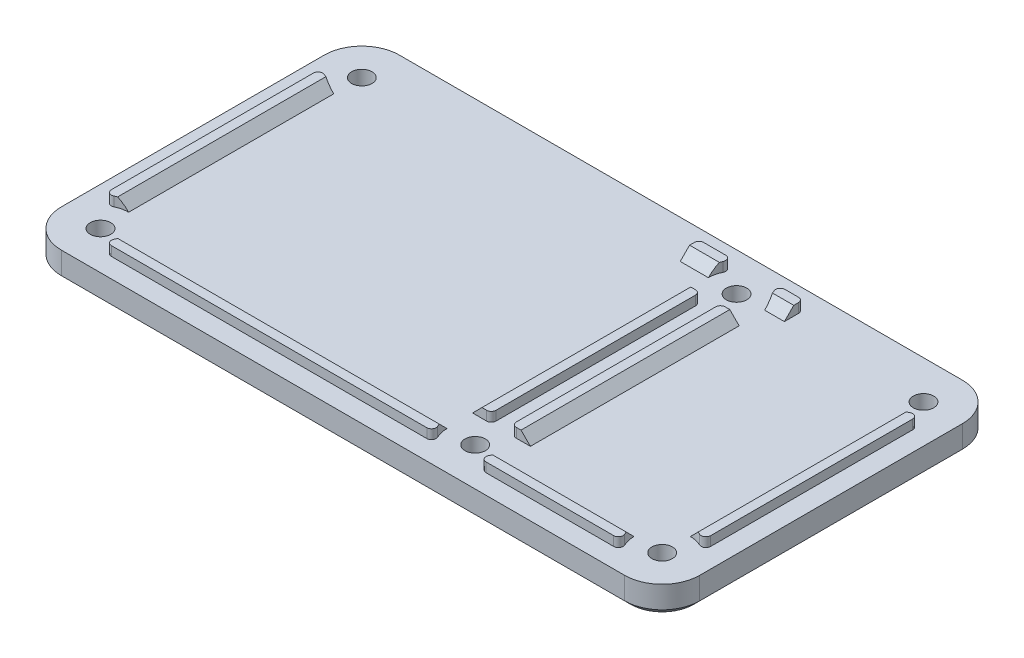
from build123d import *

# Parameters (mm, degrees)
BOSS_EXTRUDE1_DEPTH   = 4.7625
BOSS_EXTRUDE2_DEPTH   = 1.5875
SKETCH3_W             = 50.8
SKETCH3_H             = 1.5875
SKETCH3_W_2           = 20.32
CUT_EXTRUDE1_DEPTH    = 62.257755886
F_4_CLEARANCE_HOLE1_D = 3.4544
SKETCH6_R             = 4.7625
CUT_EXTRUDE2_DEPTH    = 62.257755886
SKETCH7_W             = 8.127020596
SKETCH7_H             = 2.415508094
SKETCH7_W_2           = 9.383301438
SKETCH7_H_2           = 3.436417543
CUT_EXTRUDE3_DEPTH    = 62.257755886
CHAMFER1_SIZE         = 1.5875
FILLET1_R             = 0.79375
CHAMFER2_SIZE         = 1.016


with BuildPart() as part:
    # Sketch1 → Boss-Extrude1 (new body)
    with BuildSketch(Plane(origin=(0, 0, 0), x_dir=(1, 0, 0), z_dir=(0, 1, 0))):
        with BuildLine():
            Line((-47.625, 28.575), (47.625, 28.575))
            ThreePointArc((47.625, 28.575), (52.115128061, 26.715128061), (53.975, 22.225))
            Line((53.975, 22.225), (53.975, -22.225))
            ThreePointArc((53.975, -22.225), (52.115128061, -26.715128061), (47.625, -28.575))
            Line((47.625, -28.575), (-47.625, -28.575))
            ThreePointArc((-47.625, -28.575), (-52.115128061, -26.715128061), (-53.975, -22.225))
            Line((-53.975, -22.225), (-53.975, 22.225))
            ThreePointArc((-53.975, 22.225), (-52.115128061, 26.715128061), (-47.625, 28.575))
        make_face()
    extrude(amount=BOSS_EXTRUDE1_DEPTH)

    # Sketch2 → Boss-Extrude2 (add)
    # profile 1 of 2: a face of its own
    with BuildSketch(Plane(origin=(0, 4.7625, 0), x_dir=(1, 0, 0), z_dir=(0, 1, 0))):
        with BuildLine():
            Line((-50.673, 22.225), (-50.673, -22.225))
            ThreePointArc((-50.673, -22.225), (-49.780261469, -24.380261469), (-47.625, -25.273))
            Line((-47.625, -25.273), (14.1605, -25.273))
            Line((14.1605, -25.273), (14.1605, 25.273))
            Line((14.1605, 25.273), (-47.625, 25.273))
            ThreePointArc((-47.625, 25.273), (-49.780261469, 24.380261469), (-50.673, 22.225))
        make_face()
        with BuildLine():
            Line((12.573, -23.6855), (-47.625, -23.6855))
            ThreePointArc((-47.625, -23.6855), (-48.657729454, -23.257729454), (-49.0855, -22.225))
            Line((-49.0855, -22.225), (-49.0855, 22.225))
            ThreePointArc((-49.0855, 22.225), (-48.657729454, 23.257729454), (-47.625, 23.6855))
            Line((-47.625, 23.6855), (12.573, 23.6855))
            Line((12.573, 23.6855), (12.573, -23.6855))
        make_face(mode=Mode.SUBTRACT)
    # profile 2 of 2: a face of its own
    with BuildSketch(Plane(origin=(0, 4.7625, 0), x_dir=(1, 0, 0), z_dir=(0, 1, 0))):
        with BuildLine():
            Line((47.625, -25.273), (17.5895, -25.273))
            Line((17.5895, -25.273), (17.5895, 25.273))
            Line((17.5895, 25.273), (47.625, 25.273))
            ThreePointArc((47.625, 25.273), (49.780261469, 24.380261469), (50.673, 22.225))
            Line((50.673, 22.225), (50.673, -22.225))
            ThreePointArc((50.673, -22.225), (49.780261469, -24.380261469), (47.625, -25.273))
        make_face()
        with BuildLine():
            Line((19.177, -23.6855), (19.177, 23.6855))
            Line((19.177, 23.6855), (47.625, 23.6855))
            ThreePointArc((47.625, 23.6855), (48.657729454, 23.257729454), (49.0855, 22.225))
            Line((49.0855, 22.225), (49.0855, -22.225))
            ThreePointArc((49.0855, -22.225), (48.657729454, -23.257729454), (47.625, -23.6855))
            Line((47.625, -23.6855), (19.177, -23.6855))
        make_face(mode=Mode.SUBTRACT)
    extrude(amount=BOSS_EXTRUDE2_DEPTH)

    # Sketch3 → Cut-Extrude1 (cut, through all)
    with BuildSketch(Plane(origin=(0, 4.7625, 0), x_dir=(1, 0, 0), z_dir=(0, 1, 0))):
        with Locations((-19.05, 24.47925)):
            Rectangle(SKETCH3_W, SKETCH3_H)
        with Locations((34.13125, 24.47925)):
            Rectangle(SKETCH3_W_2, SKETCH3_H)
    extrude(amount=CUT_EXTRUDE1_DEPTH, mode=Mode.SUBTRACT)

    # #4 Clearance Hole1 (through all)
    with Locations(Plane(origin=(0, 0, 0), x_dir=(-1, 0, 0), z_dir=(0, -1, 0))):
        with Locations((47.498, 22.098), (47.498, -22.098), (-15.875, -22.098), (-15.875, 22.098), (-47.498, 22.098), (-47.498, -22.098)):
            Hole(F_4_CLEARANCE_HOLE1_D / 2)

    # Sketch6 → Cut-Extrude2 (cut, through all)
    with BuildSketch(Plane(origin=(0, 4.7625, 0), x_dir=(1, 0, 0), z_dir=(0, 1, 0))):
        with Locations((47.498, 22.098)):
            Circle(SKETCH6_R)
        with Locations((47.498, -22.098)):
            Circle(SKETCH6_R)
        with Locations((15.875, -22.098)):
            Circle(SKETCH6_R)
        with Locations((15.875, 22.098)):
            Circle(SKETCH6_R)
        with Locations((-47.498, 22.098)):
            Circle(SKETCH6_R)
        with Locations((-47.498, -22.098)):
            Circle(SKETCH6_R)
    extrude(amount=CUT_EXTRUDE2_DEPTH, mode=Mode.SUBTRACT)

    # Sketch7 → Cut-Extrude3 (cut, through all)
    with BuildSketch(Plane(origin=(0, 4.7625, 0), x_dir=(1, 0, 0), z_dir=(0, 1, 0))):
        with Locations((15.913089186, 18.862568703)):
            Rectangle(SKETCH7_W, SKETCH7_H)
        with Locations((15.559399745, -19.373023428)):
            Rectangle(SKETCH7_W_2, SKETCH7_H_2)
    extrude(amount=CUT_EXTRUDE3_DEPTH, mode=Mode.SUBTRACT)

    # Chamfer1
    chamfer1_edges = [part.edges().sort_by_distance(p)[0] for p in [
        (-49.0855, 4.7625, 0),
        (8.86743597, 4.7625, -23.6855),
        (22.16818903, 4.7625, -23.6855),
        (49.0855, 4.7625, 0),
        (31.6865, 4.7625, 23.6855),
        (-15.8115, 4.7625, 23.6855),
        (12.573, 4.7625, 0),
        (19.177, 4.7625, 0),
    ]]
    chamfer(chamfer1_edges, length=CHAMFER1_SIZE - 0.0001)  # a hair under: the kernel refuses the full size

    # Fillet1
    fillet1_edges = [part.edges().sort_by_distance(p)[0] for p in [
        (6.35, 5.55625, -25.273),
        (23.97125, 5.55625, -25.273),
        (50.673, 5.55625, 18.548242086),
        (43.948242086, 5.55625, 25.273),
        (14.1605, 5.55625, 17.654814656),
        (17.5895, 5.55625, 17.654814656),
        (12.325242086, 5.55625, 25.273),
        (19.424757914, 5.55625, 25.273),
        (12.325242086, 5.55625, -25.273),
        (19.424757914, 5.55625, -25.273),
        (14.1605, 5.55625, -17.654814656),
        (17.5895, 5.55625, -17.654814656),
        (-50.673, 5.55625, -18.548242086),
        (-50.673, 5.55625, 18.548242086),
        (-43.948242086, 5.55625, 25.273),
        (50.673, 5.55625, -18.548242086),
    ]]
    fillet(fillet1_edges, radius=FILLET1_R)

    # Chamfer2
    chamfer2_edges = [part.edges().sort_by_distance(p)[0] for p in [
        (0, 0, -28.575),
        (52.115128061, 0, -26.715128061),
        (53.975, 0, 0),
        (52.115128061, 0, 26.715128061),
        (0, 0, 28.575),
        (-52.115128061, 0, 26.715128061),
        (-53.975, 0, 0),
        (-52.115128061, 0, -26.715128061),
    ]]
    chamfer(chamfer2_edges, length=CHAMFER2_SIZE)


solid = part.part
